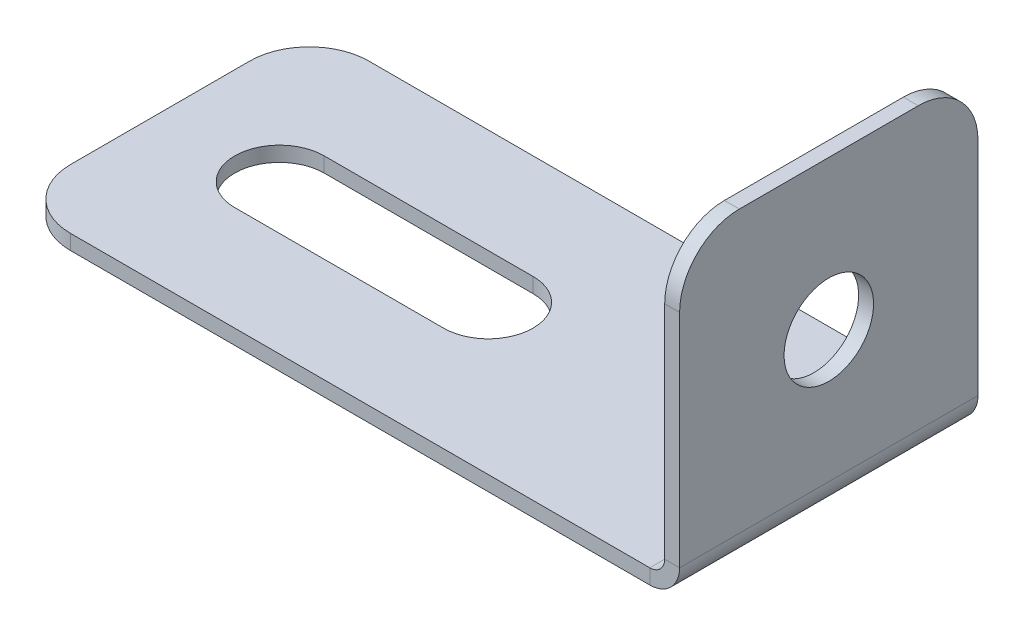
from build123d import *

# Parameters (mm, degrees)
SKETCH_1_W          = 32
SKETCH_1_H          = 10
SKETCH_1_R          = 1.5
EXTRUDE_1_DEPTH     = 0.5
OTHER_START         = -5
OTHER_1_DEPTH       = 10
OTHER_1_2_DEPTH     = 3.4999999
OTHER_START_2       = 1.5000001
OTHER_1_3_DEPTH     = 3.4999999
OTHER_START_3       = -1.5000001
OTHER_1_4_DEPTH     = 3.0000001
OTHER_START_4       = 5.910951377
OTHER_1_5_OUTLINE_R = 1.5
OTHER_1_5_DEPTH     = 0.5
FILLET_1_R          = 2


with BuildPart() as part:
    # Sketch 1 → Бобышка-Вытянуть1 (new body)
    with BuildSketch(Plane(origin=(0, 0, 0), x_dir=(1, 0, 0), z_dir=(0, 1, 0))):
        Rectangle(SKETCH_1_W, SKETCH_1_H)
        with Locations(Location((11, 0, 0), (0, 0, 270))):
            Circle(SKETCH_1_R, mode=Mode.SUBTRACT)
        with BuildLine():
            Line((-12, 1.5), (-5, 1.5))
            ThreePointArc((-5, 1.5), (-3.5, 0), (-5, -1.5))
            Line((-5, -1.5), (-12, -1.5))
            ThreePointArc((-12, -1.5), (-13.5, 0), (-12, 1.5))
        make_face(mode=Mode.SUBTRACT)
    extrude(amount=EXTRUDE_1_DEPTH)

    # Other 1: read off the stored shape, not the designer's step
    # Other 1 outline → Other 1 (cut)
    with BuildSketch(Plane.XY.offset(OTHER_START)):
        with BuildLine():
            Line((16, 0.5), (6.276976781, 0.5))
            ThreePointArc((6.276976781, 0.5), (5.910951377, 0.133974596), (5.410951377, 0))
            Line((5.410951377, 0), (16, 0))
            Line((16, 0), (16, 0.5))
        make_face()
    extrude(amount=OTHER_1_DEPTH, mode=Mode.SUBTRACT)

    # Other 1 2 outline → Other 1 2 (add)
    with BuildSketch(Plane.XY.offset(OTHER_START)):
        with BuildLine():
            Line((6.410951377, 1), (6.410951377, 10.410951377))
            Line((6.410951377, 10.410951377), (5.910951377, 10.410951377))
            Line((5.910951377, 10.410951377), (5.910951377, 1))
            ThreePointArc((5.910951377, 1), (5.764504768, 0.646446609), (5.410951377, 0.5))
            Line((5.410951377, 0.5), (6.276976781, 0.5))
            ThreePointArc((6.276976781, 0.5), (6.376877204, 0.741180955), (6.410951377, 1))
        make_face()
    extrude(amount=OTHER_1_2_DEPTH)

    # Other 1 3 outline → Other 1 3 (add)
    with BuildSketch(Plane.XY.offset(OTHER_START_2)):
        with BuildLine():
            Line((6.410951377, 1), (6.410951377, 10.410951377))
            Line((6.410951377, 10.410951377), (5.910951377, 10.410951377))
            Line((5.910951377, 10.410951377), (5.910951377, 1))
            ThreePointArc((5.910951377, 1), (5.764504768, 0.646446609), (5.410951377, 0.5))
            Line((5.410951377, 0.5), (6.276976781, 0.5))
            ThreePointArc((6.276976781, 0.5), (6.376877204, 0.741180955), (6.410951377, 1))
        make_face()
    extrude(amount=OTHER_1_3_DEPTH)

    # Other 1 4 outline → Other 1 4 (add)
    with BuildSketch(Plane.XY.offset(OTHER_START_3)):
        with BuildLine():
            Line((6.410951377, 1), (6.410951377, 10.410951377))
            Line((6.410951377, 10.410951377), (5.910951377, 10.410951377))
            Line((5.910951377, 10.410951377), (5.910951377, 1))
            ThreePointArc((5.910951377, 1), (5.764504768, 0.646446609), (5.410951377, 0.5))
            Line((5.410951377, 0.5), (6.276976781, 0.5))
            ThreePointArc((6.276976781, 0.5), (6.376877204, 0.741180955), (6.410951377, 1))
        make_face()
    extrude(amount=OTHER_1_4_DEPTH)

    # Other 1 5 outline → Other 1 5 (cut)
    with BuildSketch(Plane.YZ.offset(OTHER_START_4)):
        with Locations((5.410951377, 0)):
            Circle(OTHER_1_5_OUTLINE_R)
    extrude(amount=OTHER_1_5_DEPTH, mode=Mode.SUBTRACT)

    # Скругление1
    fillet_1_edges = [part.edges().sort_by_distance(p)[0] for p in [
        (6.160951377, 10.410951377, -5),
        (6.160951377, 10.410951377, 5),
        (-16, 0.25, 5),
        (-16, 0.25, -5),
    ]]
    fillet(fillet_1_edges, radius=FILLET_1_R)


solid = part.part
